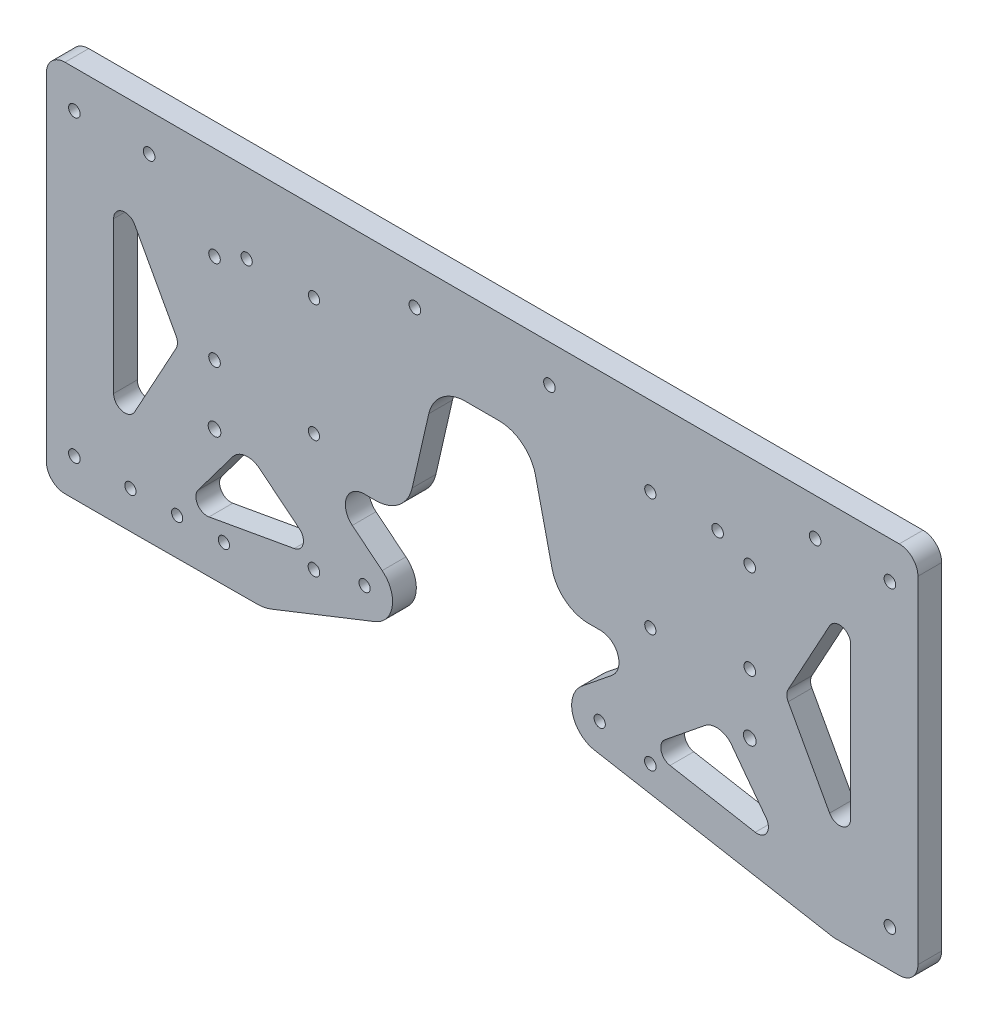
from build123d import *

# Parameters (mm, degrees)
SKETCH1_W           = 233.2
SKETCH1_H           = 100
SKETCH1_R           = 1.55
BOSS_EXTRUDE1_DEPTH = 6.35
FILLET1_R           = 5
SKETCH2_R           = 1.55
CUT_EXTRUDE1_DEPTH  = 6.35
SKETCH3_W           = 10
SKETCH3_H           = 12.7
BOSS_EXTRUDE2_DEPTH = 6.35
FILLET2_R           = 5
FILLET3_R           = 10
FILLET4_R           = 2
FILLET5_R           = 20
FILLET6_R           = 5
CUT_EXTRUDE2_DEPTH  = 10
SKETCH5_W           = 120
SKETCH5_H           = 40
CUT_EXTRUDE4_DEPTH  = 10
SKETCH6_R           = 1.5
CUT_EXTRUDE5_DEPTH  = 10
FILLET7_R           = 10
SKETCH7_W           = 25
SKETCH7_H           = 35
CUT_EXTRUDE6_DEPTH  = 10
FILLET9_R           = 10
SKETCH8_R           = 1.5
CUT_EXTRUDE7_DEPTH  = 10
BOSS_EXTRUDE3_START = -6.35
BOSS_EXTRUDE3_DEPTH = 6.35
FILLET10_R          = 5
BOSS_EXTRUDE4_START = -6.35
BOSS_EXTRUDE4_DEPTH = 6.35
FILLET11_R          = 3
FILLET12_R          = 3
CUT_EXTRUDE8_DEPTH  = 10
FILLET13_R          = 3
CUT_EXTRUDE9_DEPTH  = 10
SKETCH13_R          = 1.55
CUT_EXTRUDE10_DEPTH = 10
SKETCH14_R          = 1.5
CUT_EXTRUDE11_DEPTH = 10
BOSS_EXTRUDE5_START = -6.35
BOSS_EXTRUDE5_DEPTH = 6.35
FILLET14_R          = 10
SKETCH15_R          = 1.55
CUT_EXTRUDE12_DEPTH = 254.816001269


# Read off the part's stored shape, not the designer's step: Boss-Extrude5
with BuildPart() as part:
    # Sketch1 → Boss-Extrude1 (new body)
    with BuildSketch(Plane.XY):
        with Locations((116.6, -50)):
            Rectangle(SKETCH1_W, SKETCH1_H)
        with Locations((7.5, -10)):
            Circle(SKETCH1_R, mode=Mode.SUBTRACT)
        with Locations((225.7, -10)):
            Circle(SKETCH1_R, mode=Mode.SUBTRACT)
        with Locations((7.5, -90)):
            Circle(SKETCH1_R, mode=Mode.SUBTRACT)
        with Locations((225.7, -90)):
            Circle(SKETCH1_R, mode=Mode.SUBTRACT)
        with Locations((27.5, -10)):
            Circle(SKETCH1_R, mode=Mode.SUBTRACT)
        with Locations((205.7, -10)):
            Circle(SKETCH1_R, mode=Mode.SUBTRACT)
        with Locations((134.6, -10)):
            Circle(SKETCH1_R, mode=Mode.SUBTRACT)
        with Locations((98.6, -10)):
            Circle(SKETCH1_R, mode=Mode.SUBTRACT)
    extrude(amount=BOSS_EXTRUDE1_DEPTH)

    # Fillet1
    fillet1_edges = [part.edges().sort_by_distance(p)[0] for p in [
        (233.2, -100, 3.175),
        (0, -100, 3.175),
        (0, 0, 3.175),
        (233.2, 0, 3.175),
    ]]
    fillet(fillet1_edges, radius=FILLET1_R)

    # Sketch2 → Cut-Extrude1 (cut)
    with BuildSketch(Plane.XY.offset(6.35)):
        with Locations((45, -25)):
            Circle(SKETCH2_R)
        with Locations((45, -49)):
            Circle(SKETCH2_R)
        with Locations(Location((188.2, -49, 0), (0, 0, 180))):
            Circle(SKETCH2_R)
        with Locations(Location((188.2, -25, 0), (0, 0, 180))):
            Circle(SKETCH2_R)
    extrude(amount=-CUT_EXTRUDE1_DEPTH, mode=Mode.SUBTRACT)

    # Sketch3 → Boss-Extrude2 (add)
    with BuildSketch(Plane.XY.offset(6.35)):
        with Locations((125.723568259, 6.35)):
            Rectangle(SKETCH3_W, SKETCH3_H)
        Polygon((120.723568259, 16.7), (120.723568259, 12.7), (130.723568259, 12.7), (130.723568259, 24.7), (85.723568259, 24.7), (85.723568259, 12.7), (95.723568259, 12.7), (95.723568259, 16.7), align=None)
        Polygon((130.723568259, 12.7), (130.723568259, 0), (152.313568259, 0), (130.723568259, 24.7), align=None)
    extrude(amount=-BOSS_EXTRUDE2_DEPTH)

    # Fillet2
    fillet2_edges = [part.edges().sort_by_distance(p)[0] for p in [
        (85.723568259, 12.7, 3.175),
    ]]
    fillet(fillet2_edges, radius=FILLET2_R)

    # Fillet3
    fillet3_edges = [part.edges().sort_by_distance(p)[0] for p in [
        (120.723568259, 0, 3.175),
    ]]
    fillet(fillet3_edges, radius=FILLET3_R)

    # Fillet4
    fillet4_edges = [part.edges().sort_by_distance(p)[0] for p in [
        (85.723568259, 24.7, 3.175),
    ]]
    fillet(fillet4_edges, radius=FILLET4_R)

    # Fillet5
    fillet5_edges = [part.edges().sort_by_distance(p)[0] for p in [
        (130.723568259, 24.7, 3.175),
        (152.313568259, 0, 3.175),
    ]]
    fillet(fillet5_edges, radius=FILLET5_R)

    # Fillet6
    fillet6_edges = [part.edges().sort_by_distance(p)[0] for p in [
        (120.723568259, 16.7, 3.175),
    ]]
    fillet(fillet6_edges, radius=FILLET6_R)

    # Sketch4 → Cut-Extrude2 (cut)
    with BuildSketch(Plane(origin=(0, 0, 0), x_dir=(-1, 0, 0), z_dir=(0, 0, -1))):
        with BuildLine():
            Line((-110.723568259, 0), (-161.395157905, 0))
            ThreePointArc((-161.395157905, 0), (-153.126132222, 1.789475179), (-146.33682816, 6.837678575))
            Line((-146.33682816, 6.837678575), (-136.700308357, 17.862321425))
            ThreePointArc((-136.700308357, 17.862321425), (-129.911004296, 22.910524821), (-121.641978613, 24.7))
            Line((-121.641978613, 24.7), (-87.723568259, 24.7))
            ThreePointArc((-87.723568259, 24.7), (-86.309354696, 24.114213562), (-85.723568259, 22.7))
            Line((-85.723568259, 22.7), (-85.723568259, 17.7))
            ThreePointArc((-85.723568259, 17.7), (-87.188034353, 14.164466094), (-90.723568259, 12.7))
            Line((-90.723568259, 12.7), (-95.723568259, 12.7))
            Line((-95.723568259, 12.7), (-95.723568259, 16.7))
            Line((-95.723568259, 16.7), (-115.723568259, 16.7))
            ThreePointArc((-115.723568259, 16.7), (-119.259102165, 15.235533906), (-120.723568259, 11.7))
            Line((-120.723568259, 11.7), (-120.723568259, 10))
            ThreePointArc((-120.723568259, 10), (-117.794636071, 2.928932188), (-110.723568259, 0))
        make_face()
    extrude(amount=-CUT_EXTRUDE2_DEPTH, mode=Mode.SUBTRACT)

    # Sketch5 → Cut-Extrude4 (cut)
    with BuildSketch(Plane.XY.offset(6.35)):
        Polygon((56.6, -100), (56.6, -60), (26.6, -100), align=None)
        with Locations((116.6, -80)):
            Rectangle(SKETCH5_W, SKETCH5_H)
        Polygon((206.6, -100), (176.6, -60), (176.6, -100), align=None)
    extrude(amount=-CUT_EXTRUDE4_DEPTH, mode=Mode.SUBTRACT)

    # Sketch6 → Cut-Extrude5 (cut)
    with BuildSketch(Plane.XY.offset(6.35)):
        with Locations((71.6, -21.25)):
            Circle(SKETCH6_R)
        with Locations((161.6, -21.25)):
            Circle(SKETCH6_R)
        with Locations((161.6, -52.75)):
            Circle(SKETCH6_R)
        with Locations((71.6, -52.75)):
            Circle(SKETCH6_R)
    extrude(amount=-CUT_EXTRUDE5_DEPTH, mode=Mode.SUBTRACT)

    # Fillet7
    fillet7_edges = [part.edges().sort_by_distance(p)[0] for p in [
        (206.6, -100, 3.175),
        (26.6, -100, 3.175),
        (56.6, -60, 3.175),
        (176.6, -60, 3.175),
    ]]
    fillet(fillet7_edges, radius=FILLET7_R)

    # Sketch7 → Cut-Extrude6 (cut)
    with BuildSketch(Plane.XY.offset(6.35)):
        Polygon((96.1, -60), (104.1, -60), (104.1, -25), align=None)
        Polygon((129.1, -25), (129.1, -60), (137.1, -60), align=None)
        with Locations((116.6, -42.5)):
            Rectangle(SKETCH7_W, SKETCH7_H)
    extrude(amount=-CUT_EXTRUDE6_DEPTH, mode=Mode.SUBTRACT)

    # Fillet9
    fillet9_edges = [part.edges().sort_by_distance(p)[0] for p in [
        (137.1, -60, 3.175),
        (96.1, -60, 3.175),
        (104.1, -25, 3.175),
        (129.1, -25, 3.175),
    ]]
    fillet(fillet9_edges, radius=FILLET9_R)

    # Sketch8 → Cut-Extrude7 (cut)
    with BuildSketch(Plane.XY.offset(6.35)):
        with Locations((53.6, -21.25)):
            Circle(SKETCH8_R)
    extrude(amount=-CUT_EXTRUDE7_DEPTH, mode=Mode.SUBTRACT)

    # Sketch9 → Boss-Extrude3 (add)
    with BuildSketch(Plane.XY.offset(6.35).offset(BOSS_EXTRUDE3_START)):
        with BuildLine():
            Line((53.6, -64), (52.97582451, -64.832233986))
            Line((52.97582451, -64.832233986), (80.428117061, -87.022837132))
            ThreePointArc((80.428117061, -87.022837132), (90.975638571, -85.904897064), (89.857698503, -75.357375554))
            Line((89.857698503, -75.357375554), (70.858883385, -60))
            Line((70.858883385, -60), (61.6, -60))
            ThreePointArc((61.6, -60), (57.127864045, -61.05572809), (53.6, -64))
        make_face()
        with BuildLine():
            ThreePointArc((83.976361625, -80.247148199), (85.642998156, -79.775924736), (86.642907782, -81.190106343))
            ThreePointArc((86.642907782, -81.190106343), (84.642817409, -82.60428795), (83.976361625, -80.247148199))
        make_face(mode=Mode.SUBTRACT)
    boss_extrude3 = extrude(amount=BOSS_EXTRUDE3_DEPTH)

    # Mirror1: Boss-Extrude3 across plane
    add(boss_extrude3.mirror(Plane.ZY.offset(-116.6)))

    # Fillet10
    fillet10_edges = [part.edges().sort_by_distance(p)[0] for p in [
        (52.97582451, -64.832233986, 3.175),
        (70.858883385, -60, 3.175),
        (180.22417549, -64.832233986, 3.175),
        (162.341116615, -60, 3.175),
    ]]
    fillet(fillet10_edges, radius=FILLET10_R)

    # Sketch10 → Boss-Extrude4 (add)
    with BuildSketch(Plane.XY.offset(6.35).offset(BOSS_EXTRUDE4_START)):
        with BuildLine():
            ThreePointArc((29.6, -96), (26.844092638, -98.514663376), (23.358283237, -99.844208453))
            Line((23.358283237, -99.844208453), (86.46162021, -88.573262682))
            ThreePointArc((86.46162021, -88.573262682), (83.276282006, -88.454107183), (80.428117061, -87.022837132))
            Line((80.428117061, -87.022837132), (72.798322589, -80.855419933))
            Line((72.798322589, -80.855419933), (36.033483436, -87.422022085))
            Line((36.033483436, -87.422022085), (29.6, -96))
        make_face()
    boss_extrude4 = extrude(amount=BOSS_EXTRUDE4_DEPTH)

    # Fillet11
    fillet11_edges = [part.edges().sort_by_distance(p)[0] for p in [
        (36.033483436, -87.422022085, 3.175),
        (72.798322589, -80.855419933, 3.175),
    ]]
    fillet(fillet11_edges, radius=FILLET11_R)

    # Mirror3: Boss-Extrude4 across plane
    add(boss_extrude4.mirror(Plane.ZY.offset(-116.6)))

    # Fillet12
    fillet12_edges = [part.edges().sort_by_distance(p)[0] for p in [
        (197.166516564, -87.422022085, 3.175),
        (160.401677411, -80.855419933, 3.175),
    ]]
    fillet(fillet12_edges, radius=FILLET12_R)

    # Sketch11 → Cut-Extrude8 (cut)
    with BuildSketch(Plane.XY.offset(6.35)):
        Polygon((35.5, -50), (18, -82), (18, -18), align=None)
        Polygon((215.2, -18), (215.2, -82), (197.7, -50), align=None)
    extrude(amount=-CUT_EXTRUDE8_DEPTH, mode=Mode.SUBTRACT)

    # Fillet13
    fillet13_edges = [part.edges().sort_by_distance(p)[0] for p in [
        (35.5, -50, 3.175),
        (18, -82, 3.175),
        (18, -18, 3.175),
        (215.2, -18, 3.175),
        (215.2, -82, 3.175),
        (197.7, -50, 3.175),
    ]]
    fillet(fillet13_edges, radius=FILLET13_R)

    # Sketch12 → Cut-Extrude9 (cut)
    with BuildSketch(Plane.XY.offset(6.35)):
        with BuildLine():
            ThreePointArc((186.5, -65), (188.2, -66.7), (189.9, -65))
            ThreePointArc((189.9, -65), (188.2, -63.3), (186.5, -65))
        make_face()
        with BuildLine():
            ThreePointArc((43.3, -65), (45, -66.7), (46.7, -65))
            ThreePointArc((46.7, -65), (45, -63.3), (43.3, -65))
        make_face()
    extrude(amount=-CUT_EXTRUDE9_DEPTH, mode=Mode.SUBTRACT)

    # Sketch13 → Cut-Extrude10 (cut)
    with BuildSketch(Plane.XY.offset(6.35)):
        with Locations((161.599999999, -84.25)):
            Circle(SKETCH13_R)
        with Locations((71.6, -84.25)):
            Circle(SKETCH13_R)
    extrude(amount=-CUT_EXTRUDE10_DEPTH, mode=Mode.SUBTRACT)

    # Sketch14 → Cut-Extrude11 (cut)
    with BuildSketch(Plane(origin=(0, 0, 0), x_dir=(-1, 0, 0), z_dir=(0, 0, -1))):
        with Locations((-22.5, -90)):
            Circle(SKETCH14_R)
        with Locations((-35, -90)):
            Circle(SKETCH14_R)
        with Locations((-47.5, -90)):
            Circle(SKETCH14_R)
    extrude(amount=-CUT_EXTRUDE11_DEPTH, mode=Mode.SUBTRACT)

    # Boss-Extrude5 outline → Boss-Extrude5 (add)
    with BuildSketch(Plane(origin=(0, 0, 0), x_dir=(-1, 0, 0), z_dir=(0, 0, -1)).offset(BOSS_EXTRUDE5_START)):
        with BuildLine():
            Line((-87.900343264, -88.164814191), (-58.358283237, -99.844208453))
            Line((-58.358283237, -99.844208453), (-21.684763887, -99.999640748))
            ThreePointArc((-21.684763887, -99.999640748), (-22.524794828, -99.957145902), (-23.358283237, -99.844208453))
            Line((-23.358283237, -99.844208453), (-86.46162021, -88.573262682))
            ThreePointArc((-86.46162021, -88.573262682), (-87.191188278, -88.404990057), (-87.900343264, -88.164814191))
        make_face()
    extrude(amount=BOSS_EXTRUDE5_DEPTH)

    # Fillet14
    fillet14_edges = [part.edges().sort_by_distance(p)[0] for p in [
        (58.358283237, -99.844208453, 3.175),
    ]]
    fillet(fillet14_edges, radius=FILLET14_R)

    # Sketch15 → Cut-Extrude12 (cut, through all)
    with BuildSketch(Plane(origin=(0, 0, 0), x_dir=(-1, 0, 0), z_dir=(0, 0, -1))):
        with Locations((-179.6, -21.25)):
            Circle(SKETCH15_R)
    extrude(amount=-CUT_EXTRUDE12_DEPTH, mode=Mode.SUBTRACT)


solid = part.part
